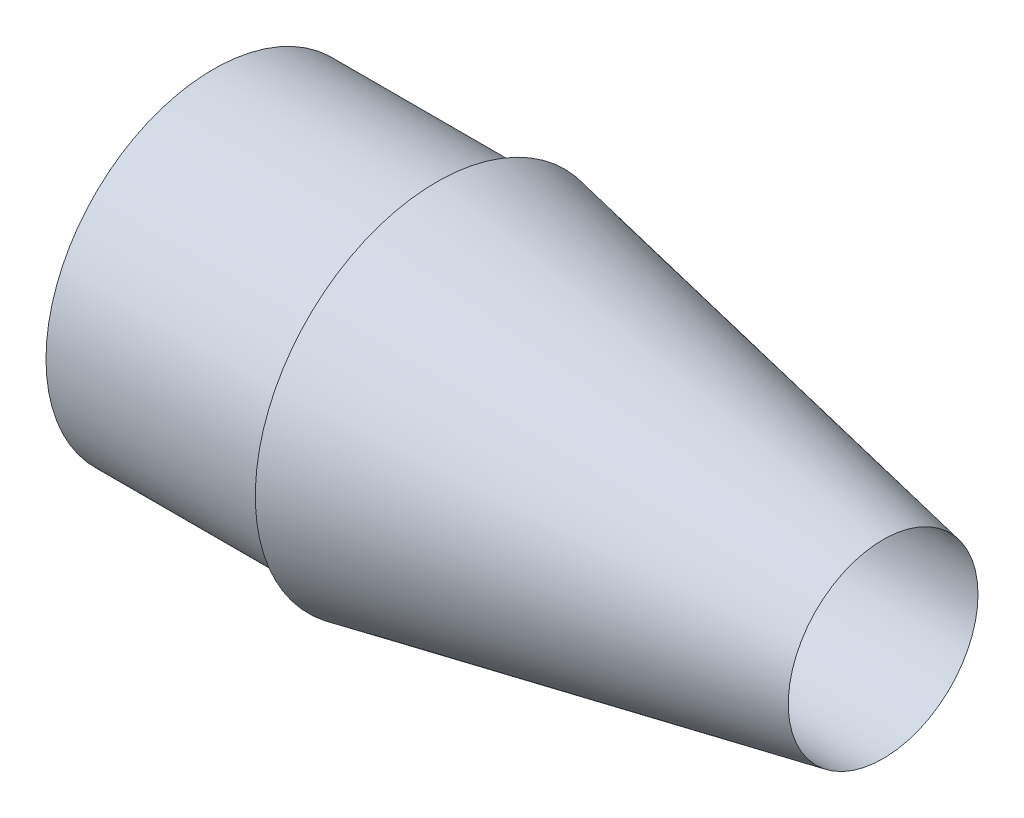
from build123d import *


with BuildPart() as part:
    # Sketch2 → Revolve1 (revolve)
    with BuildSketch(Plane.XY):
        Polygon((0, 21.59), (101.6, 21.59), (0, 41.275), (0, 38.1), (-50.8, 38.1), (0, 19.05), align=None)
    revolve(axis=Axis((109.22, 0, 0), (-1, 0, 0)))


solid = part.part
